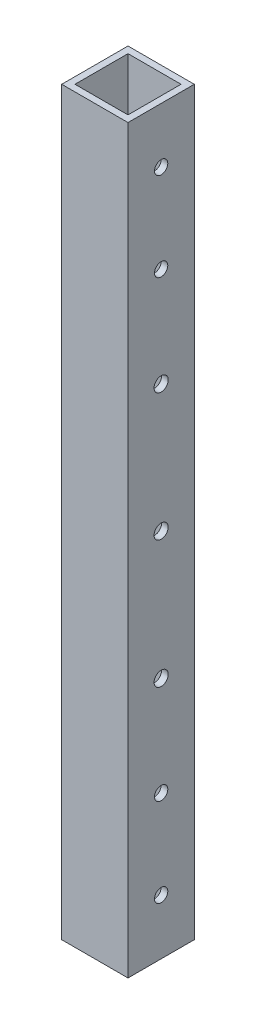
from build123d import *

# Parameters (mm, degrees)
SKETCH_1_W                = 15
SKETCH_1_H                = 15
SKETCH_1_W_2              = 12
SKETCH_1_H_2              = 12
EXTRUDE_1_DEPTH           = 167.65
CUT_EXTRUDE_1_OUTLINE_R   = 1.5
CUT_EXTRUDE_1_OUTLINE_R_2 = 1.6
CUT_EXTRUDE_1_DEPTH       = 15


# Read off the part's stored shape, not the designer's step: 切除-拉伸1
with BuildPart() as part:
    # 草图1 → 凸台-拉伸1 (new body)
    with BuildSketch(Plane(origin=(0, 0, 0), x_dir=(1, 0, 0), z_dir=(0, 1, 0))):
        with Locations((7.5, 7.5)):
            Rectangle(SKETCH_1_W, SKETCH_1_H)
        with Locations((7.5, 7.5)):
            Rectangle(SKETCH_1_W_2, SKETCH_1_H_2, mode=Mode.SUBTRACT)
    extrude(amount=EXTRUDE_1_DEPTH)

    # 切除-拉伸1 outline → 切除-拉伸1 (cut)
    with BuildSketch(Plane.YZ):
        with Locations((12.5, -7.5)):
            Circle(CUT_EXTRUDE_1_OUTLINE_R)
        with Locations((32.5, -7.5)):
            Circle(CUT_EXTRUDE_1_OUTLINE_R)
        with Locations((54.975, -7.5)):
            Circle(CUT_EXTRUDE_1_OUTLINE_R_2)
        with Locations((83.825, -7.5)):
            Circle(CUT_EXTRUDE_1_OUTLINE_R_2)
        with Locations((112.675, -7.5)):
            Circle(CUT_EXTRUDE_1_OUTLINE_R_2)
        with Locations((135.15, -7.5)):
            Circle(CUT_EXTRUDE_1_OUTLINE_R)
        with Locations((155.15, -7.5)):
            Circle(CUT_EXTRUDE_1_OUTLINE_R)
    extrude(amount=CUT_EXTRUDE_1_DEPTH, mode=Mode.SUBTRACT)


solid = part.part
